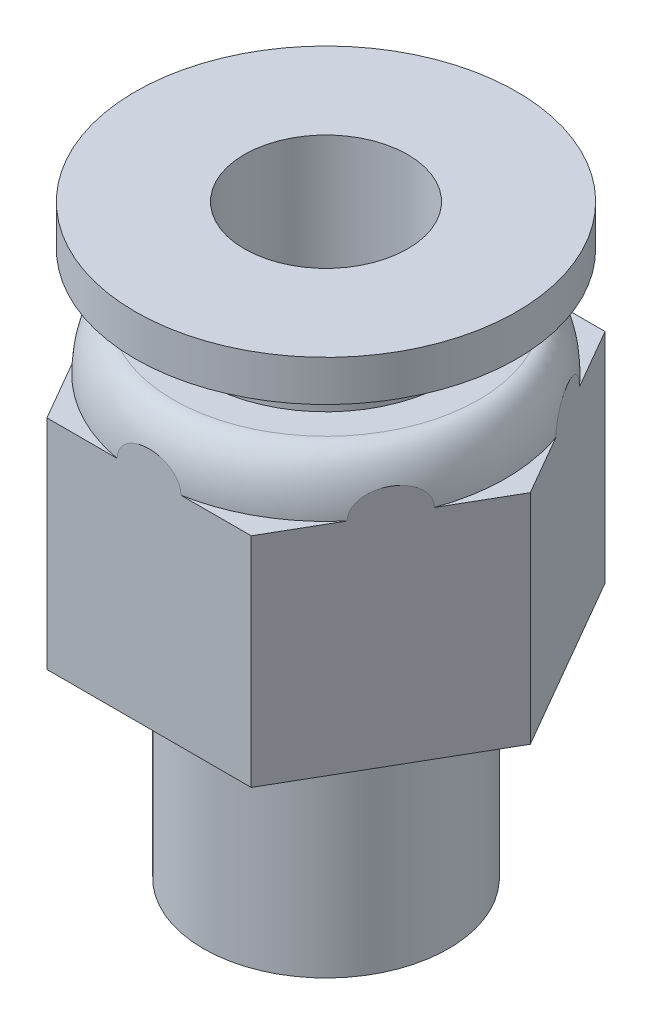
from build123d import *

# Parameters (mm, degrees)
FILLET1_SIZE       = 1
FILLET1_SIZE_2     = 2
CUT_EXTRUDE1_DEPTH = 20.19635382
CIRPATTERN1_COUNT  = 6
SKETCH6_R          = 3
CUT_EXTRUDE2_DEPTH = 21.553284565


with BuildPart() as part:
    # Sketch1 → Revolve1 (revolve)
    with BuildSketch(Plane.XY, mode=Mode.PRIVATE) as revolve1_sk:
        Polygon((0, 10), (6.6, 10), (6.6, 8), (7.5, 8), (7.5, 0), (4.5, 0), (4.5, -8), (0, -8), align=None)
    revolve(revolve1_sk.sketch.rotate(Axis((0, 22.612667954, 0), (0, -1, 0)), 90), axis=Axis((0, 22.612667954, 0), (0, -1, 0)))

    # Fillet1
    # an asymmetric fillet: 2, 1 mm, written as the material it takes off along each edge
    with BuildSketch(Plane(origin=(0, 10, 0), x_dir=(0, 0, 1), z_dir=(1, 0, 0))) as fillet1_piece_1:
        with BuildLine():
            Bezier((6.6 - FILLET1_SIZE, 0), (6.6, 0), (6.6, FILLET1_SIZE_2), weights=[1, 0.707106781, 1])
            Line((6.6, FILLET1_SIZE_2), (6.6, 0))
            Line((6.6, 0), (6.6 - FILLET1_SIZE, 0))
        make_face()
    revolve(axis=Axis((0, 10, 0), (0, -1, 0)), mode=Mode.SUBTRACT)

    # Sketch2 → Cut-Extrude1 (cut, symmetric)
    with BuildSketch(Plane(origin=(0, 8, 0), x_dir=(1, 0, 0), z_dir=(0, 1, 0))):
        with BuildLine():
            Line((3.75, 6.495190528), (7.5, 0))
            ThreePointArc((7.5, 0), (6.495190528, 3.75), (3.75, 6.495190528))
        make_face()
    cut_extrude1 = extrude(amount=CUT_EXTRUDE1_DEPTH, both=True, mode=Mode.SUBTRACT)

    # CirPattern1: Cut-Extrude1 ×6 about axis
    cirpattern1_axis = Axis((0, 0, 0), (0, 1, 0))
    for i in range(1, CIRPATTERN1_COUNT):
        add(cut_extrude1.rotate(cirpattern1_axis, i * 360 / CIRPATTERN1_COUNT), mode=Mode.SUBTRACT)

    # Sketch6 → Cut-Extrude2 (cut, through all)
    with BuildSketch(Plane.XZ.offset(8)):
        with Locations(Location((0, 0, 0), (0, 0, 270))):
            Circle(SKETCH6_R)
    extrude(amount=-CUT_EXTRUDE2_DEPTH, mode=Mode.SUBTRACT)

    # Sketch7 → Revolve2 (revolve)
    with BuildSketch(Plane.XY, mode=Mode.PRIVATE) as revolve2_sk:
        Polygon((3, 10), (3, 13.5), (7, 13.5), (7, 12), (4.5, 12), (4.5, 10), align=None)
    revolve(revolve2_sk.sketch.rotate(Axis((0, 10.01, 0), (0, -1, 0)), 90), axis=Axis((0, 10.01, 0), (0, -1, 0)))


solid = part.part
